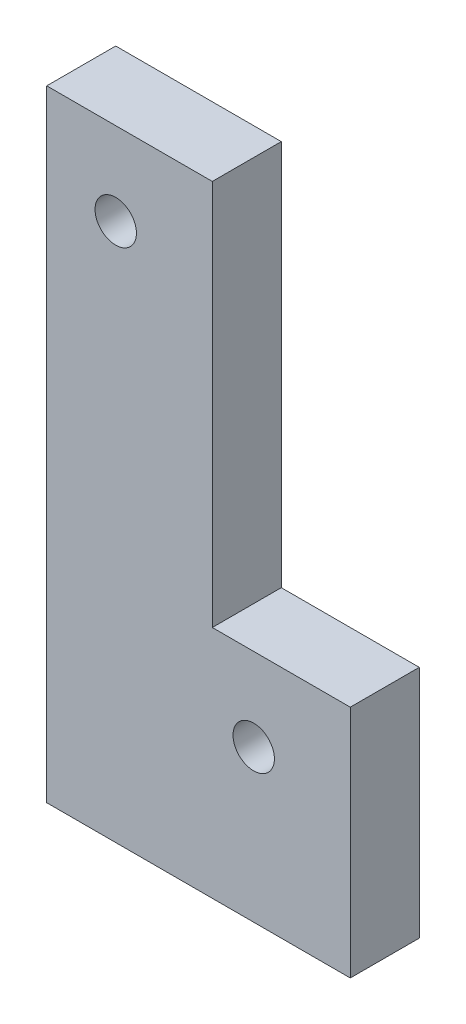
from build123d import *

# Parameters (mm, degrees)
ESQUISSE1_R        = 1.5
BOSS_EXTRU_1_DEPTH = 5


with BuildPart() as part:
    # Esquisse1 → Boss.-Extru.1 (new body)
    with BuildSketch(Plane.XY):
        Polygon((0, 0), (22, 0), (22, 17), (12, 17), (12, 45), (0, 45), align=None)
        with Locations((5, 39)):
            Circle(ESQUISSE1_R, mode=Mode.SUBTRACT)
        with Locations((15, 11)):
            Circle(ESQUISSE1_R, mode=Mode.SUBTRACT)
    extrude(amount=BOSS_EXTRU_1_DEPTH)


solid = part.part
